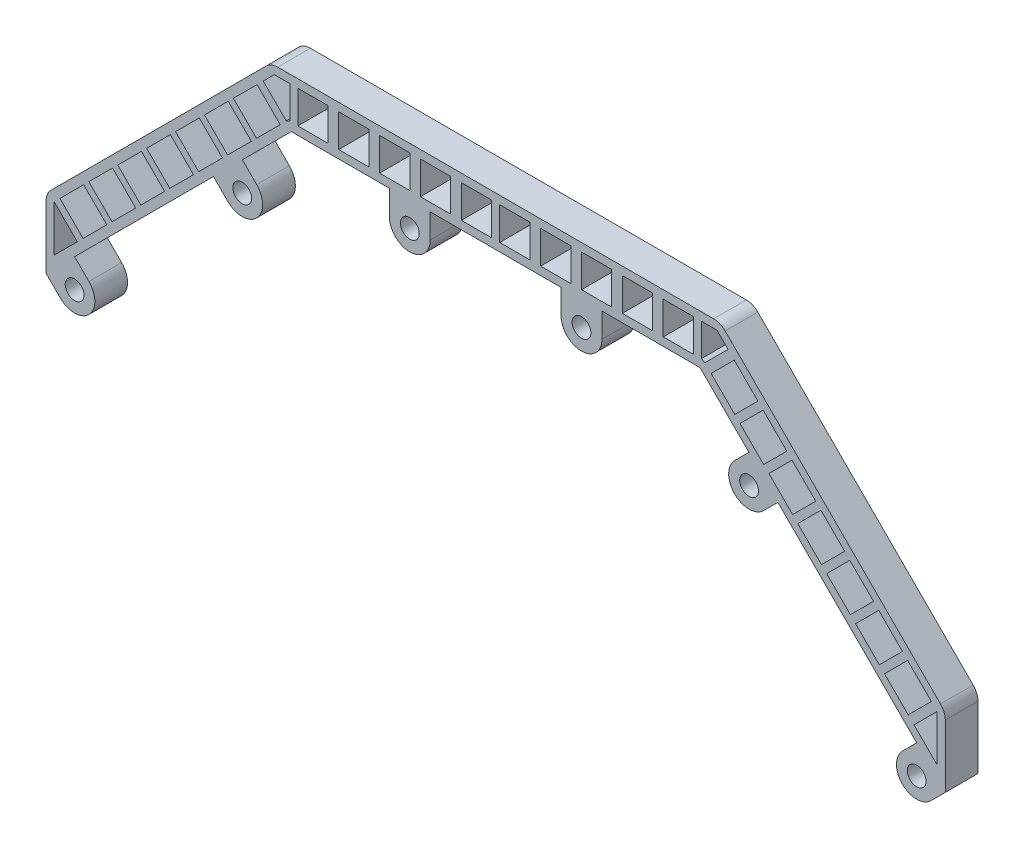
from build123d import *

# Parameters (mm, degrees)
SKETCH3_R                = 1.15
BOSS_EXTRUDE1_DEPTH      = 2
FILLET1_R                = 2
CUT_EXTRUDE1_DEPTH       = 83.231380871
CUT_EXTRUDE2_DEPTH       = 83.158383626
LPATTERN1_COUNT          = 7
LPATTERN1_PITCH          = 5
SKETCH7_W                = 3.7
SKETCH7_H                = 4
CUT_EXTRUDE3_DEPTH       = 83.158383626
LPATTERN2_COUNT          = 5
LPATTERN2_PITCH          = 5
MIRROR1_COPY_1_DEPTH     = 83.158383626
MIRROR1_COPY_2_DEPTH     = 83.158383626
MIRROR1_COPY_3_DEPTH     = 83.158383626
MIRROR1_COPY_4_DEPTH     = 83.158383626
MIRROR1_COPY_5_DEPTH     = 83.158383626
MIRROR1_COPY_6_DEPTH     = 83.158383626
MIRROR1_COPY_7_SKETCH_W  = 3.7
MIRROR1_COPY_7_SKETCH_H  = 4
MIRROR1_COPY_7_DEPTH     = 83.158383626
MIRROR1_COPY_8_SKETCH_W  = 3.7
MIRROR1_COPY_8_SKETCH_H  = 4
MIRROR1_COPY_8_DEPTH     = 83.158383626
MIRROR1_COPY_9_SKETCH_W  = 3.7
MIRROR1_COPY_9_SKETCH_H  = 4
MIRROR1_COPY_9_DEPTH     = 83.158383626
MIRROR1_COPY_10_SKETCH_W = 3.7
MIRROR1_COPY_10_SKETCH_H = 4
MIRROR1_COPY_10_DEPTH    = 83.158383626
FILLET1_OF_MIRROR1_R     = 2


with BuildPart() as part:
    # Sketch3 → Boss-Extrude1 (new, symmetric)
    with BuildSketch(Plane.XY):
        with BuildLine():
            Line((-55, 25), (-53.25, 23.25))
            ThreePointArc((-53.25, 23.25), (-49.75, 23.25), (-49.75, 26.75))
            Line((-49.75, 26.75), (-51.5, 28.5))
            Line((-51.5, 28.5), (-34.517766953, 45.482233047))
            Line((-34.517766953, 45.482233047), (-32.767766953, 43.732233047))
            ThreePointArc((-32.767766953, 43.732233047), (-29.232233047, 43.732233047), (-29.232233047, 47.267766953))
            Line((-29.232233047, 47.267766953), (-30.982233047, 49.017766953))
            Line((-30.982233047, 49.017766953), (-25, 55))
            Line((-25, 55), (-13, 55))
            Line((-13, 55), (-13, 52))
            ThreePointArc((-13, 52), (-10.5, 49.5), (-8, 52))
            Line((-8, 52), (-8, 55))
            Line((-8, 55), (0, 55))
            Line((0, 55), (0, 61))
            Line((0, 61), (-27.485281374, 61))
            Line((-27.485281374, 61), (-55, 33.485281374))
            Line((-55, 33.485281374), (-55, 25))
        make_face()
        with Locations((-10.5, 52)):
            Circle(SKETCH3_R, mode=Mode.SUBTRACT)
        with Locations((-31, 45.5)):
            Circle(SKETCH3_R, mode=Mode.SUBTRACT)
        with Locations((-51.5, 25)):
            Circle(SKETCH3_R, mode=Mode.SUBTRACT)
    boss_extrude1 = extrude(amount=BOSS_EXTRUDE1_DEPTH, both=True)

    # Fillet1
    fillet1_edges = [part.edges().sort_by_distance(p)[0] for p in [
        (-55, 33.485281374, 0),
        (-27.485281374, 61, 0),
    ]]
    fillet(fillet1_edges, radius=FILLET1_R)

    # Sketch5 → Cut-Extrude1 (cut, through all)
    with BuildSketch(Plane.XY.offset(2)):
        Polygon((-28.428256226, 58.642811585), (-27.071067812, 60), (-25.151713549, 60), (-25.151713549, 56.019550391), (-25.613653315, 55.828208674), align=None)
        Polygon((-54, 33.071067812), (-54, 27.414213562), (-51.171572875, 30.242640687), align=None)
    cut_extrude1 = extrude(amount=-CUT_EXTRUDE1_DEPTH, mode=Mode.SUBTRACT)

    # Sketch6 → Cut-Extrude2 (cut, symmetric)
    with BuildSketch(Plane.XY):
        Polygon((-53.292893219, 33.778174593), (-50.393755416, 36.677312396), (-47.565328291, 33.848885271), (-50.464466094, 30.949747468), align=None)
    cut_extrude2 = extrude(amount=CUT_EXTRUDE2_DEPTH, both=True, mode=Mode.SUBTRACT)

    # LPattern1: Cut-Extrude2 ×7
    with Locations(*[Vector(0.7071067811865472, 0.7071067811865478, 0) * (i * LPATTERN1_PITCH) for i in range(1, LPATTERN1_COUNT)]):
        add(cut_extrude2, mode=Mode.SUBTRACT)

    # Sketch7 → Cut-Extrude3 (cut, symmetric)
    with BuildSketch(Plane.XY):
        with Locations((-2.35, 58)):
            Rectangle(SKETCH7_W, SKETCH7_H)
    cut_extrude3 = extrude(amount=CUT_EXTRUDE3_DEPTH, both=True, mode=Mode.SUBTRACT)

    # LPattern2: Cut-Extrude3 ×5
    with Locations(*[(-i * LPATTERN2_PITCH, 0, 0) for i in range(1, LPATTERN2_COUNT)]):
        add(cut_extrude3, mode=Mode.SUBTRACT)

    # Mirror1: Boss-Extrude1, Cut-Extrude1, Cut-Extrude2, Cut-Extrude3 across plane
    add(boss_extrude1.mirror(Plane(origin=(0, 55, 2), x_dir=(0, 0, 1), z_dir=(-1, 0, 0))))
    add(cut_extrude1.mirror(Plane(origin=(0, 55, 2), x_dir=(0, 0, 1), z_dir=(-1, 0, 0))), mode=Mode.SUBTRACT)
    add(cut_extrude2.mirror(Plane(origin=(0, 55, 2), x_dir=(0, 0, 1), z_dir=(-1, 0, 0))), mode=Mode.SUBTRACT)
    add(cut_extrude3.mirror(Plane(origin=(0, 55, 2), x_dir=(0, 0, 1), z_dir=(-1, 0, 0))), mode=Mode.SUBTRACT)

    # Mirror1 copy 1 sketch → Mirror1 copy 1 (cut, symmetric)
    with BuildSketch(Plane(origin=(-3.535533906, 3.535533906, 0), x_dir=(-1, 0, 0), z_dir=(0, 0, 1))):
        Polygon((-53.292893219, -33.778174593), (-50.393755416, -36.677312396), (-47.565328291, -33.848885271), (-50.464466094, -30.949747468), align=None)
    extrude(amount=MIRROR1_COPY_1_DEPTH, both=True, mode=Mode.SUBTRACT)

    # Mirror1 copy 2 sketch → Mirror1 copy 2 (cut, symmetric)
    with BuildSketch(Plane(origin=(-7.071067812, 7.071067812, 0), x_dir=(-1, 0, 0), z_dir=(0, 0, 1))):
        Polygon((-53.292893219, -33.778174593), (-50.393755416, -36.677312396), (-47.565328291, -33.848885271), (-50.464466094, -30.949747468), align=None)
    extrude(amount=MIRROR1_COPY_2_DEPTH, both=True, mode=Mode.SUBTRACT)

    # Mirror1 copy 3 sketch → Mirror1 copy 3 (cut, symmetric)
    with BuildSketch(Plane(origin=(-10.606601718, 10.606601718, 0), x_dir=(-1, 0, 0), z_dir=(0, 0, 1))):
        Polygon((-53.292893219, -33.778174593), (-50.393755416, -36.677312396), (-47.565328291, -33.848885271), (-50.464466094, -30.949747468), align=None)
    extrude(amount=MIRROR1_COPY_3_DEPTH, both=True, mode=Mode.SUBTRACT)

    # Mirror1 copy 4 sketch → Mirror1 copy 4 (cut, symmetric)
    with BuildSketch(Plane(origin=(-14.142135624, 14.142135624, 0), x_dir=(-1, 0, 0), z_dir=(0, 0, 1))):
        Polygon((-53.292893219, -33.778174593), (-50.393755416, -36.677312396), (-47.565328291, -33.848885271), (-50.464466094, -30.949747468), align=None)
    extrude(amount=MIRROR1_COPY_4_DEPTH, both=True, mode=Mode.SUBTRACT)

    # Mirror1 copy 5 sketch → Mirror1 copy 5 (cut, symmetric)
    with BuildSketch(Plane(origin=(-17.67766953, 17.67766953, 0), x_dir=(-1, 0, 0), z_dir=(0, 0, 1))):
        Polygon((-53.292893219, -33.778174593), (-50.393755416, -36.677312396), (-47.565328291, -33.848885271), (-50.464466094, -30.949747468), align=None)
    extrude(amount=MIRROR1_COPY_5_DEPTH, both=True, mode=Mode.SUBTRACT)

    # Mirror1 copy 6 sketch → Mirror1 copy 6 (cut, symmetric)
    with BuildSketch(Plane(origin=(-21.213203436, 21.213203436, 0), x_dir=(-1, 0, 0), z_dir=(0, 0, 1))):
        Polygon((-53.292893219, -33.778174593), (-50.393755416, -36.677312396), (-47.565328291, -33.848885271), (-50.464466094, -30.949747468), align=None)
    extrude(amount=MIRROR1_COPY_6_DEPTH, both=True, mode=Mode.SUBTRACT)

    # Mirror1 copy 7 sketch → Mirror1 copy 7 (cut, symmetric)
    with BuildSketch(Plane(origin=(5, 0, 0), x_dir=(-1, 0, 0), z_dir=(0, 0, 1))):
        with Locations((-2.35, -58)):
            Rectangle(MIRROR1_COPY_7_SKETCH_W, MIRROR1_COPY_7_SKETCH_H)
    extrude(amount=MIRROR1_COPY_7_DEPTH, both=True, mode=Mode.SUBTRACT)

    # Mirror1 copy 8 sketch → Mirror1 copy 8 (cut, symmetric)
    with BuildSketch(Plane(origin=(10, 0, 0), x_dir=(-1, 0, 0), z_dir=(0, 0, 1))):
        with Locations((-2.35, -58)):
            Rectangle(MIRROR1_COPY_8_SKETCH_W, MIRROR1_COPY_8_SKETCH_H)
    extrude(amount=MIRROR1_COPY_8_DEPTH, both=True, mode=Mode.SUBTRACT)

    # Mirror1 copy 9 sketch → Mirror1 copy 9 (cut, symmetric)
    with BuildSketch(Plane(origin=(15, 0, 0), x_dir=(-1, 0, 0), z_dir=(0, 0, 1))):
        with Locations((-2.35, -58)):
            Rectangle(MIRROR1_COPY_9_SKETCH_W, MIRROR1_COPY_9_SKETCH_H)
    extrude(amount=MIRROR1_COPY_9_DEPTH, both=True, mode=Mode.SUBTRACT)

    # Mirror1 copy 10 sketch → Mirror1 copy 10 (cut, symmetric)
    with BuildSketch(Plane(origin=(20, 0, 0), x_dir=(-1, 0, 0), z_dir=(0, 0, 1))):
        with Locations((-2.35, -58)):
            Rectangle(MIRROR1_COPY_10_SKETCH_W, MIRROR1_COPY_10_SKETCH_H)
    extrude(amount=MIRROR1_COPY_10_DEPTH, both=True, mode=Mode.SUBTRACT)

    # Fillet1 of Mirror1
    fillet1_of_mirror1_edges = [part.edges().sort_by_distance(p)[0] for p in [
        (55, 33.485281374, 0),
        (27.485281374, 61, 0),
    ]]
    fillet(fillet1_of_mirror1_edges, radius=FILLET1_OF_MIRROR1_R)


solid = part.part
